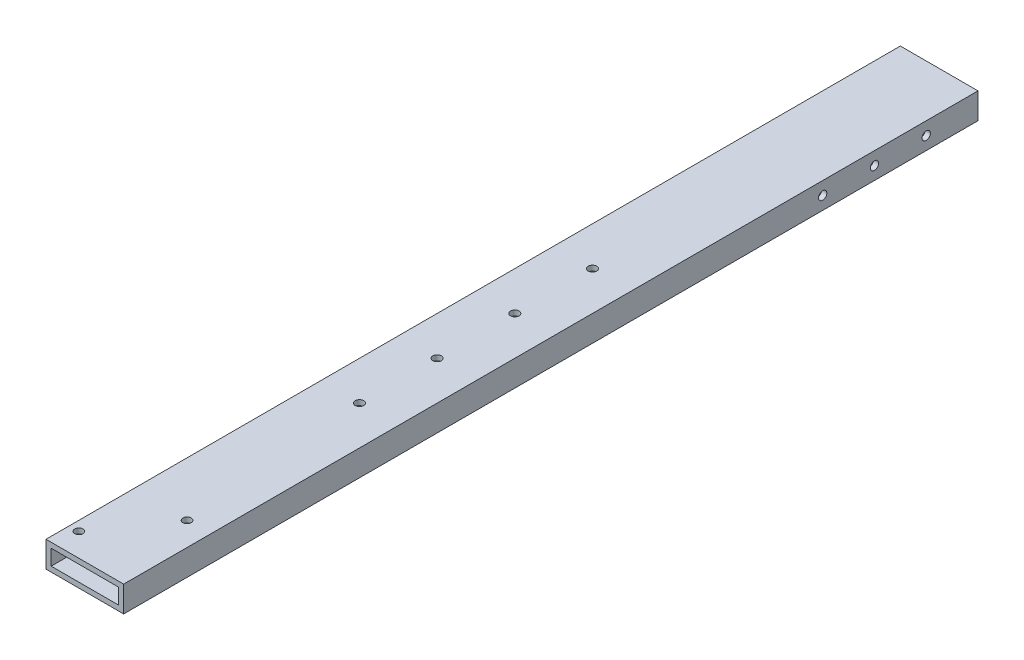
from build123d import *

# Parameters (mm, degrees)
SKETCH_1_W          = 30
SKETCH_1_H          = 10
SKETCH_1_W_2        = 26
SKETCH_1_H_2        = 6
EXTRUDE_1_DEPTH     = 330
SKETCH_2_R          = 1.6
CUT_EXTRUDE_1_DEPTH = 331.492057393
SKETCH_3_R          = 1.6
SKETCH_3_R_2        = 1.65
CUT_EXTRUDE_2_DEPTH = 331.492057393
SKETCH_4_R          = 1.6
CUT_EXTRUDE_3_DEPTH = 332.398551596


with BuildPart() as part:
    # 草图1 → 凸台-拉伸1 (new body)
    with BuildSketch(Plane.XY):
        Rectangle(SKETCH_1_W, SKETCH_1_H)
        Rectangle(SKETCH_1_W_2, SKETCH_1_H_2, mode=Mode.SUBTRACT)
    extrude(amount=EXTRUDE_1_DEPTH)

    # 草图2 → 切除-拉伸1 (cut, through all)
    with BuildSketch(Plane(origin=(0, 5, 0), x_dir=(1, 0, 0), z_dir=(0, 1, 0))):
        with Locations((-11.3, -321)):
            Circle(SKETCH_2_R)
    extrude(amount=-CUT_EXTRUDE_1_DEPTH, mode=Mode.SUBTRACT)

    # 草图3 → 切除-拉伸2 (cut, through all)
    with BuildSketch(Plane(origin=(0, 5, 0), x_dir=(1, 0, 0), z_dir=(0, 1, 0))):
        with Locations((5.907293091, -296.425438671)):
            Circle(SKETCH_3_R)
        with Locations((0, -163.912345182)):
            Circle(SKETCH_3_R_2)
        with Locations((0, -133.912345182)):
            Circle(SKETCH_3_R_2)
        with Locations((0, -223.912345182)):
            Circle(SKETCH_3_R_2)
        with Locations((0, -193.912345182)):
            Circle(SKETCH_3_R_2)
    extrude(amount=-CUT_EXTRUDE_2_DEPTH, mode=Mode.SUBTRACT)

    # 草图4 → 切除-拉伸3 (cut, through all)
    with BuildSketch(Plane.ZY.offset(15)):
        with Locations((20, 0)):
            Circle(SKETCH_4_R)
        with Locations((40, 0)):
            Circle(SKETCH_4_R)
        with Locations((60, 0)):
            Circle(SKETCH_4_R)
    extrude(amount=-CUT_EXTRUDE_3_DEPTH, mode=Mode.SUBTRACT)


solid = part.part
